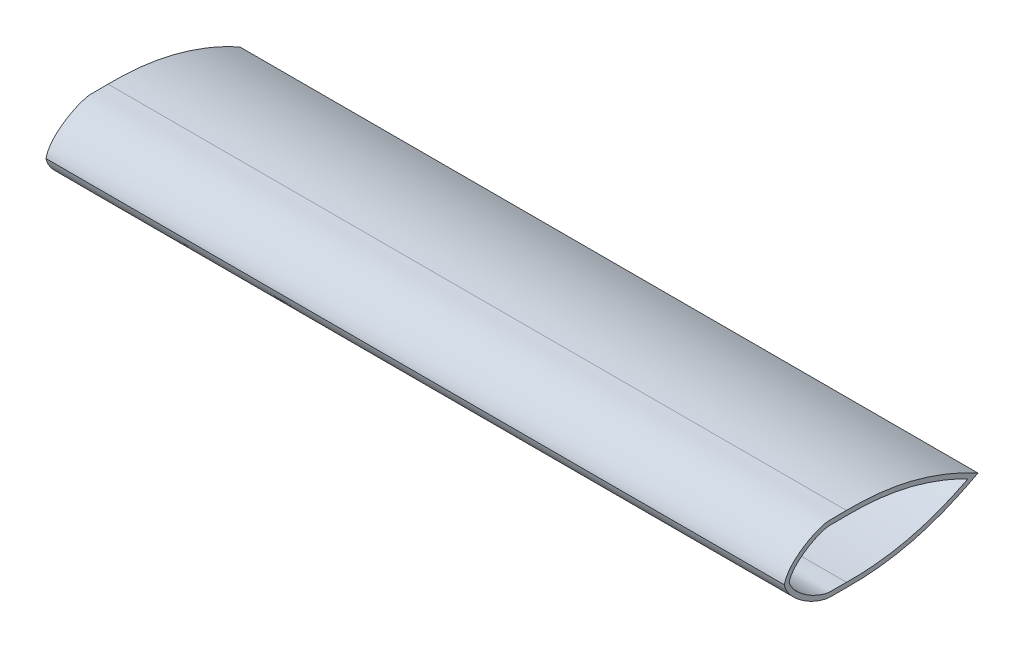
from build123d import *

# Parameters (mm, degrees)
BOSS_EXTRUDE1_DEPTH      = 98.610323
BOSS_EXTRUDE1_DEPTH_BACK = 87.674643
SKETCH1_R                = 7.9375
SKETCH1_R_2              = 6.4643
EXTRUDE_THIN1_START      = -203.2
EXTRUDE_THIN1_DEPTH      = 203.2


# Read off the part's stored shape, not the designer's step: Extrude-Thin1
with BuildPart() as part:
    # Sketch1 → Boss-Extrude1 (new, two sides: drawn at the far end of the back side and taken through both)
    with BuildSketch(Plane(origin=(0, 0, 0), x_dir=(0, 0, -1), z_dir=(1, 0, 0)).offset(-BOSS_EXTRUDE1_DEPTH_BACK)):
        with Locations(Location((0, 0, 0), (0, 0, 180))):
            Circle(SKETCH1_R)
        with Locations(Location((0, 0, 0), (0, 0, 180))):
            Circle(SKETCH1_R_2, mode=Mode.SUBTRACT)
    extrude(amount=BOSS_EXTRUDE1_DEPTH + BOSS_EXTRUDE1_DEPTH_BACK)


with BuildPart() as body_2:
    # Extrude-Thin1 outline → Extrude-Thin1 (new body)
    with BuildSketch(Plane.ZY.offset(87.674642954).offset(EXTRUDE_THIN1_START)):
        with BuildLine():
            add(Edge.make_bspline(
                [(17.102094562, 0), (17.04739702, 0.213797016), (16.995336819, 0.42880706), (16.862538118, 0.845636753), (16.785160791, 1.049002351), (16.524638716, 1.646041309), (16.313322861, 2.026757553), (15.952145288, 2.577500677), (15.823799266, 2.758298236), (15.55747882, 3.108894312), (15.419296606, 3.279121061), (14.991807723, 3.776732023), (14.689672994, 4.091162254), (14.058517718, 4.692872976), (13.729440661, 4.980096404), (13.048538768, 5.531572182), (12.695830839, 5.79630298), (11.621386484, 6.549823619), (10.879692917, 7.002537116), (9.350485078, 7.81841744), (8.563418356, 8.182458905), (7.337712392, 8.640371405), (6.920131838, 8.778488758), (6.068362945, 9.009083778), (5.641217648, 9.100109427), (4.782855054, 9.20377314), (4.351397815, 9.211792234), (3.486983413, 9.198956322), (3.054597909, 9.189105956), (1.758100925, 9.172251023), (0.894552451, 9.176084553), (0.032418914, 9.207156149)],
                knots=[0, 0, 0, 0, 0.03125, 0.03125, 0.0625, 0.0625, 0.125, 0.125, 0.15625, 0.15625, 0.1875, 0.1875, 0.25, 0.25, 0.3125, 0.3125, 0.375, 0.375, 0.5, 0.5, 0.625, 0.625, 0.6875, 0.6875, 0.75, 0.75, 0.8125, 0.8125, 0.875, 0.875, 1, 1, 1, 1], degree=3))
            add(Edge.make_bspline(
                [(0.032418914, 9.207156149), (-3.121526951, 9.254567879), (-6.268108602, 9.110594057), (-10.968108502, 8.569736414), (-12.52521706, 8.336275013), (-15.620025789, 7.761375356), (-17.159089419, 7.419573925), (-21.738086481, 6.234254823), (-24.724357097, 5.234488958), (-29.105751606, 3.451071682), (-30.544977721, 2.811540258), (-32.674611159, 1.79028171), (-33.379214501, 1.438672145), (-34.780824408, 0.719336072), (-35.481629362, 0.359668036), (-36.182434315, 0)],
                knots=[0, 0, 0, 0, 0.25, 0.25, 0.375, 0.375, 0.5, 0.5, 0.75, 0.75, 0.875, 0.875, 0.9375, 0.9375, 1, 1, 1, 1], degree=3))
            add(Edge.make_bspline(
                [(-36.182434315, 0), (-35.481521346, -0.359723472), (-34.780608377, -0.719446944), (-33.378782439, -1.438893888), (-32.674037428, -1.790565857), (-30.54384954, -2.812063227), (-29.103490823, -3.452048995), (-26.182421908, -4.640936279), (-24.705875102, -5.18815569), (-21.718958236, -6.182841679), (-20.207183631, -6.630656344), (-15.628240433, -7.815624895), (-12.531730425, -8.389928975), (-6.265599348, -9.11075463), (-3.121472775, -9.254567065), (0.032418914, -9.207156149)],
                knots=[0, 0, 0, 0, 0.0625, 0.0625, 0.125, 0.125, 0.25, 0.25, 0.375, 0.375, 0.5, 0.5, 0.75, 0.75, 1, 1, 1, 1], degree=3))
            add(Edge.make_bspline(
                [(0.032418914, -9.207156149), (0.905514517, -9.175689476), (1.779125635, -9.172233827), (3.089959502, -9.189718729), (3.526990194, -9.200223759), (4.400877656, -9.211783508), (4.837511077, -9.200702397), (5.491209368, -9.116060671), (5.709156111, -9.077545633), (6.137233482, -8.98673913), (6.348502946, -8.934293247), (6.975926684, -8.760718275), (7.385801524, -8.623619453), (8.597622689, -8.167045839), (9.38212336, -7.803203601), (10.531369419, -7.187490205), (10.910587265, -6.969553739), (11.651698354, -6.513571235), (12.014278322, -6.275223658), (13.076641296, -5.527228859), (13.752024112, -4.98589787), (14.696235941, -4.084483233), (15.000618027, -3.767120438), (15.567824422, -3.105568901), (15.83163431, -2.760825125), (16.188955162, -2.216615083), (16.301620626, -2.030666021), (16.511878279, -1.648130786), (16.609863922, -1.450611941), (16.785610923, -1.048088593), (16.863353526, -0.843382437), (16.996060883, -0.426225712), (17.047692544, -0.212641899), (17.102094562, 0)],
                knots=[0, 0, 0, 0, 0.125, 0.125, 0.1875, 0.1875, 0.25, 0.25, 0.28125, 0.28125, 0.3125, 0.3125, 0.375, 0.375, 0.5, 0.5, 0.5625, 0.5625, 0.625, 0.625, 0.75, 0.75, 0.8125, 0.8125, 0.875, 0.875, 0.90625, 0.90625, 0.9375, 0.9375, 0.96875, 0.96875, 1, 1, 1, 1], degree=3))
        make_face()
        with BuildLine():
            add(Edge.make_bspline(
                [(0, 7.9375), (-11.980740822, 8.117600633), (-22.750058366, 5.466290217), (-33.401, 0)],
                knots=[0, 0, 0, 0, 1, 1, 1, 1], degree=3))
            add(Edge.make_bspline(
                [(15.791190362, 0), (14.817942328, 3.804147623), (7.441618018, 7.989029069), (3.229273207, 7.925930538), (1.470189631, 7.884513847), (0, 7.9375)],
                knots=[0, 0, 0, 0, 0.663308265, 0.763308265, 1, 1, 1, 1], degree=3))
            add(Edge.make_bspline(
                [(0, -7.9375), (1.470189631, -7.884513847), (3.229273207, -7.925930538), (7.441618018, -7.989029069), (14.817942328, -3.804147623), (15.791190362, 0)],
                knots=[0, 0, 0, 0, 0.236691735, 0.336691735, 1, 1, 1, 1], degree=3))
            add(Edge.make_bspline(
                [(-33.401, 0), (-22.750058366, -5.466290217), (-11.980740822, -8.117600633), (0, -7.9375)],
                knots=[0, 0, 0, 0, 1, 1, 1, 1], degree=3))
        make_face(mode=Mode.SUBTRACT)
    extrude(amount=EXTRUDE_THIN1_DEPTH)


solid = Compound([part.part, body_2.part])
